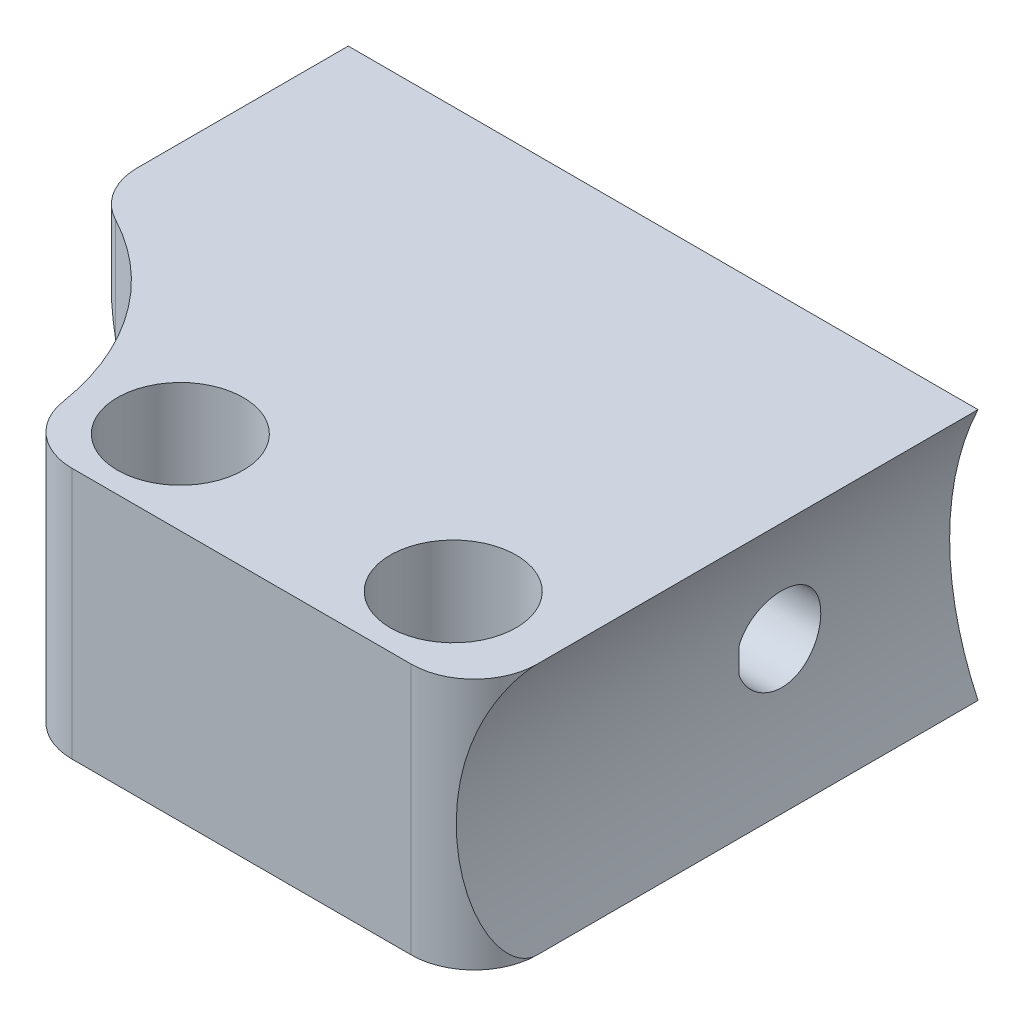
from build123d import *

# Parameters (mm, degrees)
SKETCH_1_R               = 3
EXTRUDE_1_DEPTH          = 12
FILLET_1_R               = 3
FILLET_2_R               = 3
CUT_EXTRUDE_1_DEPTH      = 23
CUT_EXTRUDE_2_DEPTH      = 35.467375879
SKETCH_2_4_R             = 2
CUT_EXTRUDE_3_DEPTH      = 3
CUT_EXTRUDE_8_DEPTH      = 31.740852386
CUT_EXTRUDE_8_DEPTH_BACK = 31.740852386


with BuildPart() as part:
    # 草图1 → 凸台-拉伸1 (new body)
    with BuildSketch(Plane(origin=(0, 0, 0), x_dir=(1, 0, 0), z_dir=(0, 1, 0))):
        with BuildLine():
            Line((-15, 12), (15, 12))
            Line((15, 12), (15, -12))
            Line((15, -12), (-7, -12))
            ThreePointArc((-7, -12), (-8.996142529, -4.664095019), (-15, 0))
            Line((-15, 0), (-15, 12))
        make_face()
        with Locations((10, -8)):
            Circle(SKETCH_1_R, mode=Mode.SUBTRACT)
        with Locations((-3, -8)):
            Circle(SKETCH_1_R, mode=Mode.SUBTRACT)
    extrude(amount=EXTRUDE_1_DEPTH)

    # 圆角1
    fillet_1_edges = [part.edges().sort_by_distance(p)[0] for p in [
        (-7, 6, 12),
        (-15, 6, 0),
    ]]
    fillet(fillet_1_edges, radius=FILLET_1_R)

    # 圆角2
    fillet_2_edges = [part.edges().sort_by_distance(p)[0] for p in [
        (15, 6, 12),
    ]]
    fillet(fillet_2_edges, radius=FILLET_2_R)

    # 草图2 → 切除-拉伸1 (cut)
    with BuildSketch(Plane.ZY.offset(15)):
        Polygon((-6.32871818, 2), (-6.32871818, 10), (-12, 9), (-12, 3), align=None)
    extrude(amount=-CUT_EXTRUDE_1_DEPTH, mode=Mode.SUBTRACT)

    # 草图2<3> → 切除-拉伸2 (cut, through all)
    with BuildSketch(Plane.ZY.offset(15)):
        with BuildLine():
            Line((-1.956143181, 5.390242862), (-1.956143181, 6.609757138))
            ThreePointArc((-1.956143181, 6.609757138), (-5.860925645, 6), (-1.956143181, 5.390242862))
        make_face()
    extrude(amount=-CUT_EXTRUDE_2_DEPTH, mode=Mode.SUBTRACT)

    # 草图2<4> → 切除-拉伸3 (cut)
    with BuildSketch(Plane.ZY.offset(15)):
        with BuildLine():
            ThreePointArc((-6.32871818, 2), (0.839074355, 6), (-6.32871818, 10))
            Line((-6.32871818, 10), (-6.32871818, 2))
        make_face()
        with Locations((-3.860925645, 6)):
            Circle(SKETCH_2_4_R, mode=Mode.SUBTRACT)
    extrude(amount=-CUT_EXTRUDE_3_DEPTH, mode=Mode.SUBTRACT)

    # 草图4 → 切除-拉伸8 (cut, two sides: drawn at the far end of the back side and taken through both)
    with BuildSketch(Plane(origin=(0, 0, -12), x_dir=(-1, 0, 0), z_dir=(0, 0, -1)).offset(-CUT_EXTRUDE_8_DEPTH_BACK)):
        with BuildLine():
            Line((-46.980847691, 79.421546804), (-15, 12))
            ThreePointArc((-15, 12), (-13.649110641, 6), (-15, 0))
            Line((-15, 0), (-46.980847691, -67.421546804))
            Line((-46.980847691, -67.421546804), (-196.224803582, -67.421546804))
            Line((-196.224803582, -67.421546804), (-196.224803582, 79.421546804))
            Line((-196.224803582, 79.421546804), (-46.980847691, 79.421546804))
        make_face()
    extrude(amount=CUT_EXTRUDE_8_DEPTH + CUT_EXTRUDE_8_DEPTH_BACK, mode=Mode.SUBTRACT)


solid = part.part
